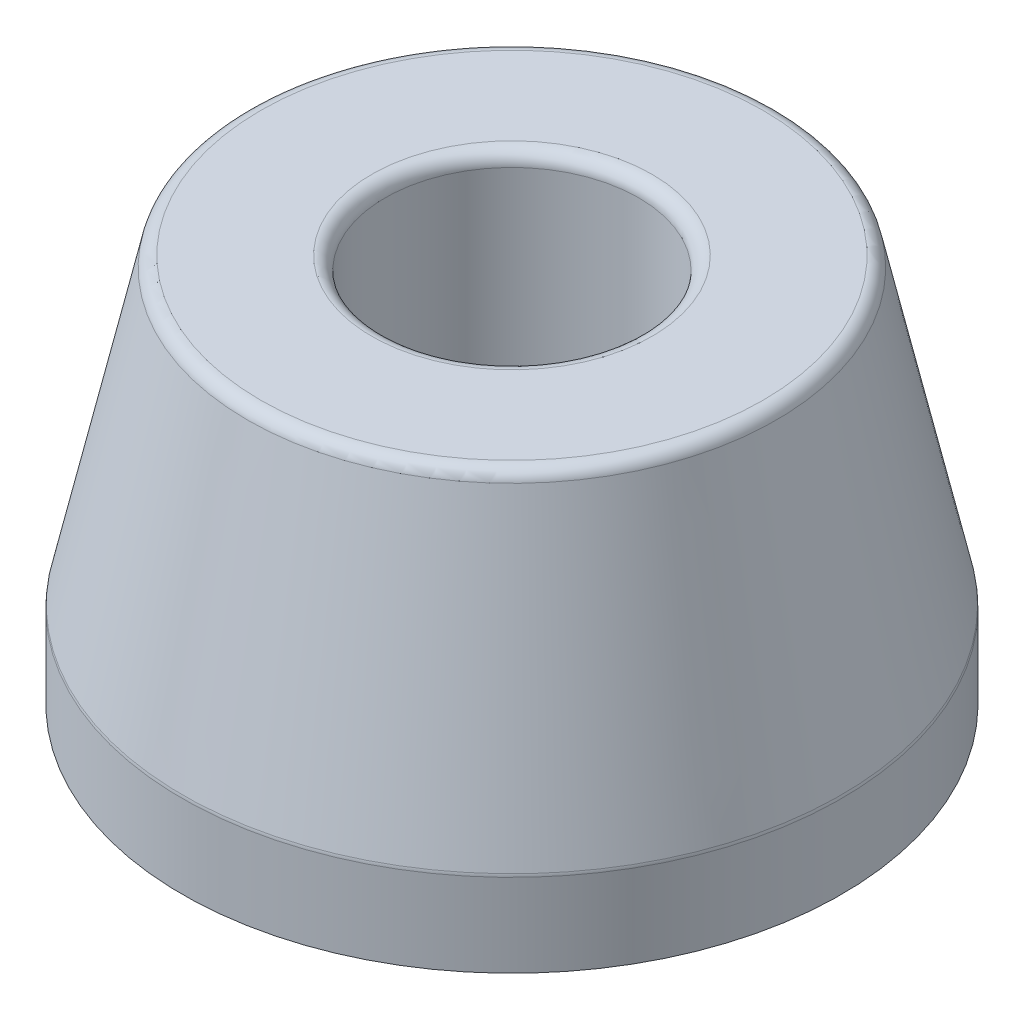
from build123d import *


with BuildPart() as part:
    # Sketch1 → Revolve1 (revolve)
    with BuildSketch(Plane.XY):
        with BuildLine():
            Line((4.7625, 0), (4.7625, 14.097))
            ThreePointArc((4.7625, 14.097), (4.911289755, 14.456210245), (5.2705, 14.605))
            Line((5.2705, 14.605), (9.434996824, 14.605))
            ThreePointArc((9.434996824, 14.605), (9.75286634, 14.493261241), (9.930899851, 14.207200673))
            Line((9.930899851, 14.207200673), (12.370403027, 3.22943638))
            ThreePointArc((12.370403027, 3.22943638), (12.379466701, 3.174667028), (12.3825, 3.119235708))
            Line((12.3825, 3.119235708), (12.3825, 0))
            Line((12.3825, 0), (4.7625, 0))
        make_face()
    revolve(axis=Axis((0, 0, 0), (0, 1, 0)))


solid = part.part
